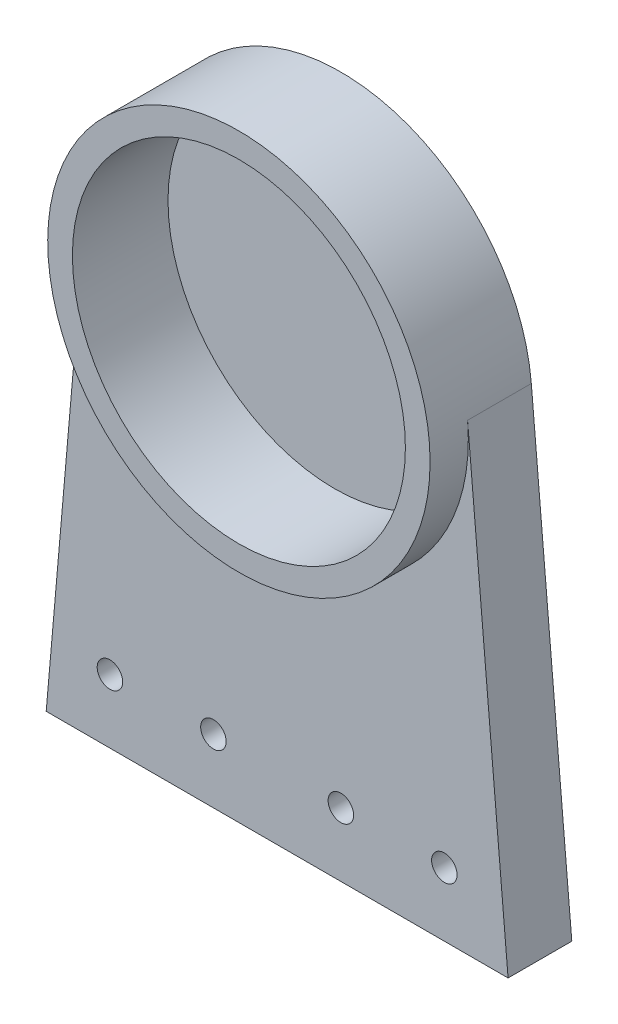
from build123d import *
from build123d.topology import SkipClean

# Parameters (mm, degrees)
SKETCH1_R           = 30
SKETCH1_R_2         = 26.125
BOSS_EXTRUDE1_DEPTH = 15
BOSS_EXTRUDE2_START = 1
SKETCH2_R           = 30
BOSS_EXTRUDE2_DEPTH = 1
BOSS_EXTRUDE3_DEPTH = 10
SKETCH7_R           = 2
CUT_EXTRUDE4_DEPTH  = 10


with BuildPart() as part:
    # Sketch1 → Boss-Extrude1 (new body)
    with BuildSketch(Plane.XY):
        Circle(SKETCH1_R)
        Circle(SKETCH1_R_2, mode=Mode.SUBTRACT)
    extrude(amount=BOSS_EXTRUDE1_DEPTH)

    # Sketch2 → Boss-Extrude2 (add)
    with BuildSketch(Plane(origin=(0, 0, 0), x_dir=(-1, 0, 0), z_dir=(0, 0, -1)).offset(BOSS_EXTRUDE2_START)):
        Circle(SKETCH2_R)
    extrude(amount=-BOSS_EXTRUDE2_DEPTH)

    # Sketch3 → Boss-Extrude3 (add)
    with SkipClean():  # the faces are left unmerged after this step: merging them gives an invalid solid
        with BuildSketch(Plane(origin=(0, 0, -1), x_dir=(-1, 0, 0), z_dir=(0, 0, -1))):
            with BuildLine():
                Line((-29.885840943, 2.614672282), (-36.238801573, -70))
                Line((-36.238801573, -70), (36.238801573, -70))
                Line((36.238801573, -70), (29.885840943, 2.614672282))
                ThreePointArc((29.885840943, 2.614672282), (0, -30), (-29.885840943, 2.614672282))
            make_face()
        extrude(amount=-BOSS_EXTRUDE3_DEPTH)

    # Sketch7 → Cut-Extrude4 (cut)
    with SkipClean():  # the faces are left unmerged after this step: merging them gives an invalid solid
        with BuildSketch(Plane.XY.offset(9)):
            with Locations((10, -60)):
                Circle(SKETCH7_R)
            with Locations((26.238801573, -60)):
                Circle(SKETCH7_R)
            with Locations((-26.238801573, -60)):
                Circle(SKETCH7_R)
            with Locations((-10, -60)):
                Circle(SKETCH7_R)
        extrude(amount=-CUT_EXTRUDE4_DEPTH, mode=Mode.SUBTRACT)


solid = part.part
